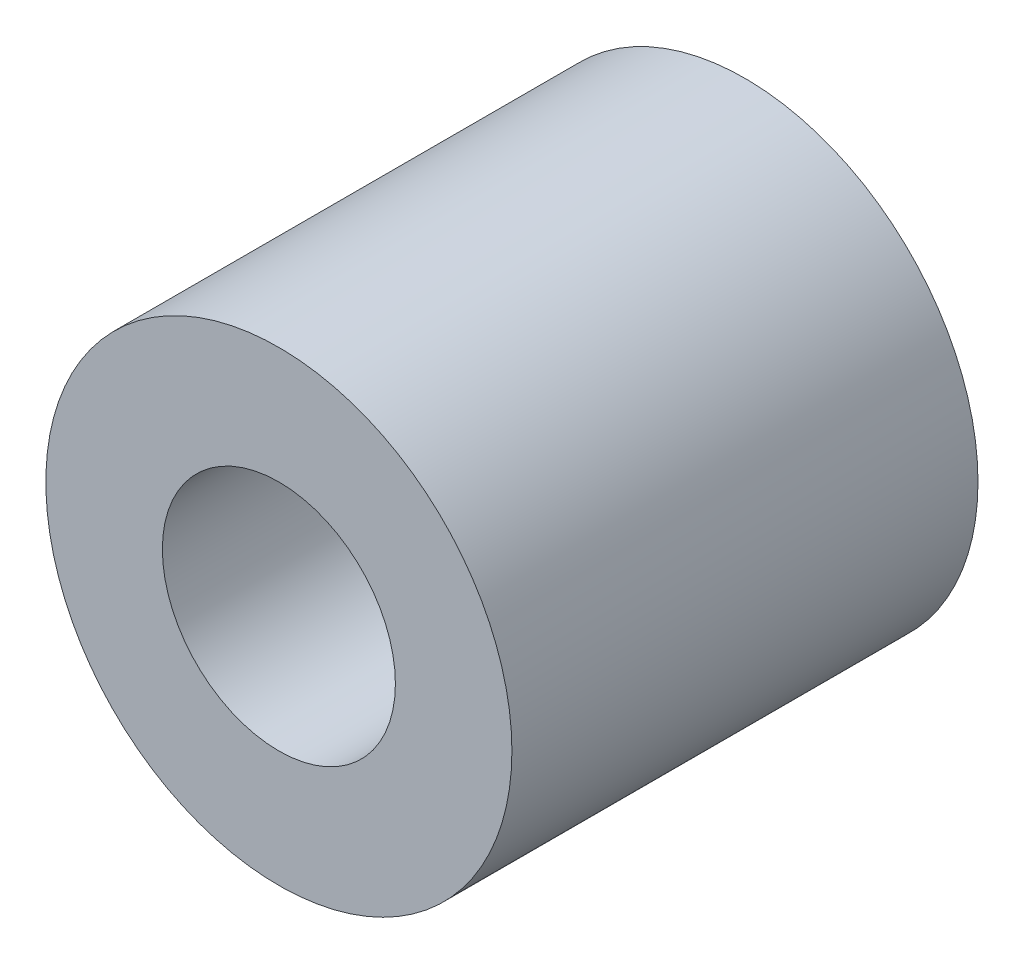
from build123d import *

# Parameters (mm, degrees)
SKETCH_1_R      = 2
SKETCH_1_R_2    = 1
EXTRUDE_2_DEPTH = 4


with BuildPart() as part:
    # 草图1 → 凸台-拉伸2 (new body)
    with BuildSketch(Plane.XY):
        Circle(SKETCH_1_R)
        Circle(SKETCH_1_R_2, mode=Mode.SUBTRACT)
    extrude(amount=EXTRUDE_2_DEPTH)


solid = part.part
